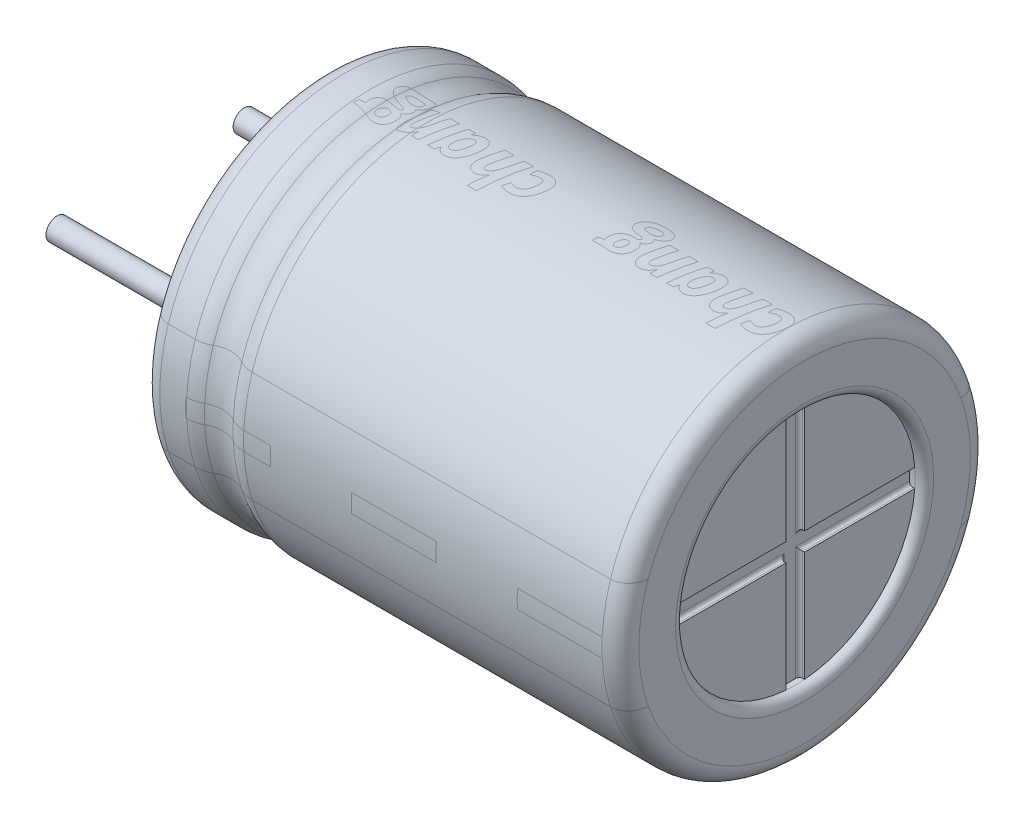
from build123d import *

# Parameters (mm, degrees)
FILLET_1_R          = 0.8
SKETCH_2_R          = 3.25
CUT_EXTRUDE_1_DEPTH = 0.25
FILLET_2_R          = 0.5
CUT_EXTRUDE_2_DEPTH = 0.15
FILLET_3_R          = 0.1
CUT_EXTRUDE_START   = -0.25
SKETCH_5_R          = 3.25
CUT_EXTRUDE_3_DEPTH = 0.25
SKETCH_6_R          = 0.3
EXTRUDE_2_DEPTH     = 5
FILLET_4_R          = 0.5
FILLET_5_R          = 0.25
FILLET_6_R          = 0.25


with BuildPart() as part:
    # Эскиз1 → Повернуть1 (revolve)
    with BuildSketch(Plane.XY, mode=Mode.PRIVATE) as revolve_1_sk:
        with BuildLine():
            Line((0, 0), (0, 5))
            Line((0, 5), (1.470849738, 5))
            ThreePointArc((1.470849738, 5), (2, 4.8), (2.529150262, 5))
            Line((2.529150262, 5), (13, 5))
            Line((13, 5), (13, 0))
            Line((13, 0), (0, 0))
        make_face()
    revolve(revolve_1_sk.sketch.rotate(Axis((-7.119144013, 0, 0), (1, 0, 0)), 90), axis=Axis((-7.119144013, 0, 0), (1, 0, 0)))

    # Скругление1
    fillet_1_edges = [part.edges().sort_by_distance(p)[0] for p in [
        (1.470849738, 0, -5),
        (2.529150262, 0, -5),
    ]]
    fillet(fillet_1_edges, radius=FILLET_1_R)

    # Эскиз2 → Вырез-Вытянуть1 (cut)
    with BuildSketch(Plane(origin=(13, 0, 0), x_dir=(0, 0, -1), z_dir=(1, 0, 0))):
        Circle(SKETCH_2_R)
    extrude(amount=-CUT_EXTRUDE_1_DEPTH, mode=Mode.SUBTRACT)

    # Скругление2
    fillet_2_edges = [part.edges().sort_by_distance(p)[0] for p in [
        (13, 0, -5),
    ]]
    fillet(fillet_2_edges, radius=FILLET_2_R)

    # Эскиз4 → Вырез-Вытянуть2 (cut)
    with BuildSketch(Plane(origin=(12.75, 0, 0), x_dir=(0, 0, -1), z_dir=(1, 0, 0))):
        with BuildLine():
            Line((-0.25, 3.240370349), (-0.25, 0.25))
            Line((-0.25, 0.25), (-3.240370349, 0.25))
            ThreePointArc((-3.240370349, 0.25), (-3.25, 0), (-3.240370349, -0.25))
            Line((-3.240370349, -0.25), (-0.25, -0.25))
            Line((-0.25, -0.25), (-0.25, -3.240370349))
            ThreePointArc((-0.25, -3.240370349), (0, -3.25), (0.25, -3.240370349))
            Line((0.25, -3.240370349), (0.25, -0.25))
            Line((0.25, -0.25), (3.240370349, -0.25))
            ThreePointArc((3.240370349, -0.25), (3.25, 0), (3.240370349, 0.25))
            Line((3.240370349, 0.25), (0.25, 0.25))
            Line((0.25, 0.25), (0.25, 3.240370349))
            ThreePointArc((0.25, 3.240370349), (0, 3.25), (-0.25, 3.240370349))
        make_face()
    extrude(amount=-CUT_EXTRUDE_2_DEPTH, mode=Mode.SUBTRACT)

    # Скругление3
    fillet_3_edges = [part.edges().sort_by_distance(p)[0] for p in [
        (12.6, 1.745185175, -0.25),
        (12.6, 0.25, -1.745185175),
        (12.6, -0.25, -1.745185175),
        (12.6, -1.745185175, -0.25),
        (12.6, -1.745185175, 0.25),
        (12.6, -0.25, 1.745185175),
        (12.6, 0.25, 1.745185175),
        (12.6, 1.745185175, 0.25),
    ]]
    fillet(fillet_3_edges, radius=FILLET_3_R)

    # Эскиз5 → Вырез-Вытянуть3 (cut)
    with BuildSketch(Plane.ZY.offset(CUT_EXTRUDE_START)):
        with Locations(Location((0, 0, 0), (0, 0, 180))):
            Circle(SKETCH_5_R)
    extrude(amount=CUT_EXTRUDE_3_DEPTH, mode=Mode.SUBTRACT)

    # Эскиз6 → Бобышка-Вытянуть2 (add)
    with BuildSketch(Plane.ZY.offset(-0.25)):
        with Locations((-2.54, 0)):
            Circle(SKETCH_6_R)
        with Locations(Location((2.54, 0, 0), (0, 0, 180))):
            Circle(SKETCH_6_R)
    extrude(amount=EXTRUDE_2_DEPTH)

    # Скругление4
    fillet_4_edges = [part.edges().sort_by_distance(p)[0] for p in [
        (0, 0, -5),
    ]]
    fillet(fillet_4_edges, radius=FILLET_4_R)

    # Скругление5
    fillet_5_edges = [part.edges().sort_by_distance(p)[0] for p in [
        (13, 0, 3.25),
    ]]
    fillet(fillet_5_edges, radius=FILLET_5_R - 0.0001)  # a hair under: the kernel refuses the full size

    # Скругление6
    fillet_6_edges = [part.edges().sort_by_distance(p)[0] for p in [
        (0, 0, 3.25),
    ]]
    fillet(fillet_6_edges, radius=FILLET_6_R - 0.0001)  # a hair under: the kernel refuses the full size


solid = part.part
